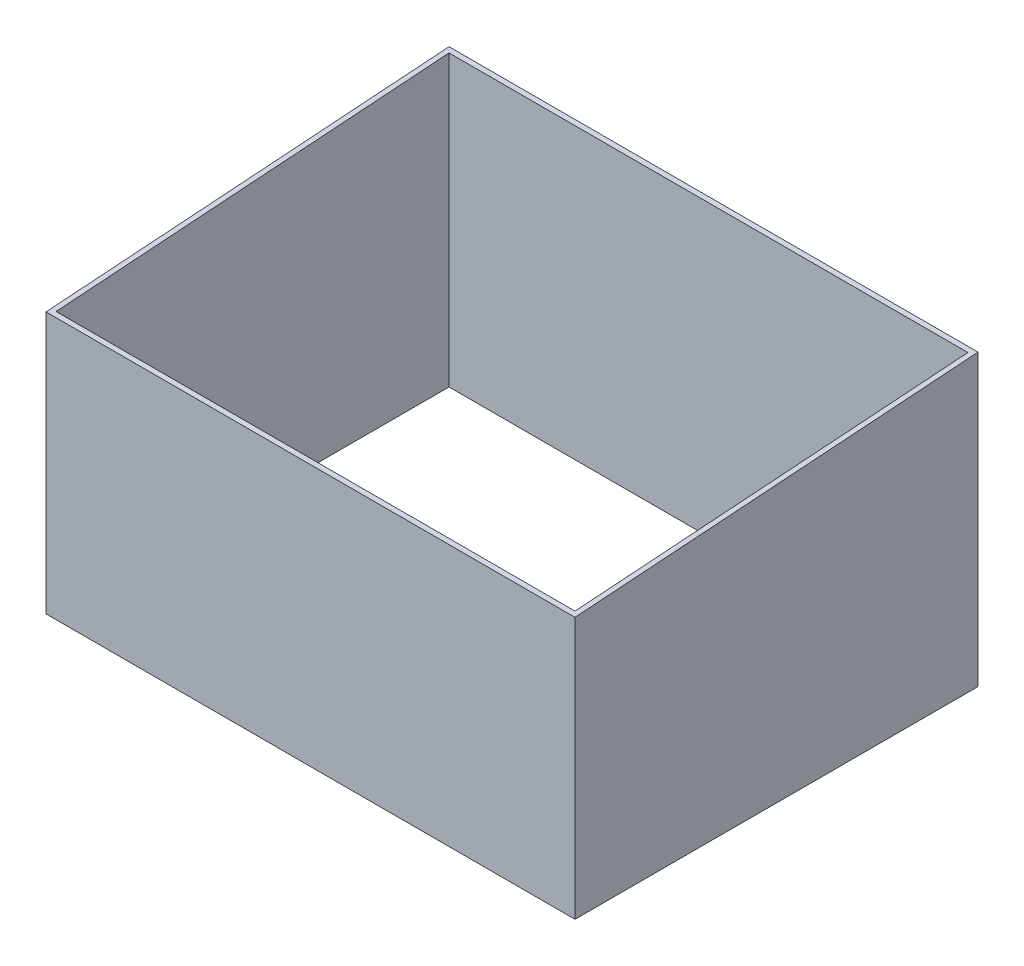
from build123d import *

# Parameters (mm, degrees)
SKETCH_1_W          = 4200
SKETCH_1_H          = 3200
SKETCH_1_W_2        = 4120
SKETCH_1_H_2        = 3120
EXTRUDE_1_DEPTH     = 2300
SKETCH_2_OUTSIDE_W  = 4353.868
SKETCH_2_OUTSIDE_H  = 3453.868
CUT_EXTRUDE_1_DEPTH = 5760.340239993


with BuildPart() as part:
    # Эскиз1 → Вытянуть-Тонкостенный1 (new body)
    with BuildSketch(Plane(origin=(0, 0, 0), x_dir=(1, 0, 0), z_dir=(0, 1, 0))):
        with Locations((2100, 1600)):
            Rectangle(SKETCH_1_W, SKETCH_1_H)
        with Locations((2100, 1600)):
            Rectangle(SKETCH_1_W_2, SKETCH_1_H_2, mode=Mode.SUBTRACT)
    extrude(amount=EXTRUDE_1_DEPTH)

    # Эскиз2 outside → Вырез-Вытянуть1 (cut, through all)
    with BuildSketch(Plane.ZY):
        with Locations((-1600, 1150)):
            Rectangle(SKETCH_2_OUTSIDE_W, SKETCH_2_OUTSIDE_H)
        Polygon((-3200, 2300), (0, 2076.446830349), (0, 0), (-3200, 0), align=None, mode=Mode.SUBTRACT)
    extrude(amount=-CUT_EXTRUDE_1_DEPTH, mode=Mode.SUBTRACT)


solid = part.part
